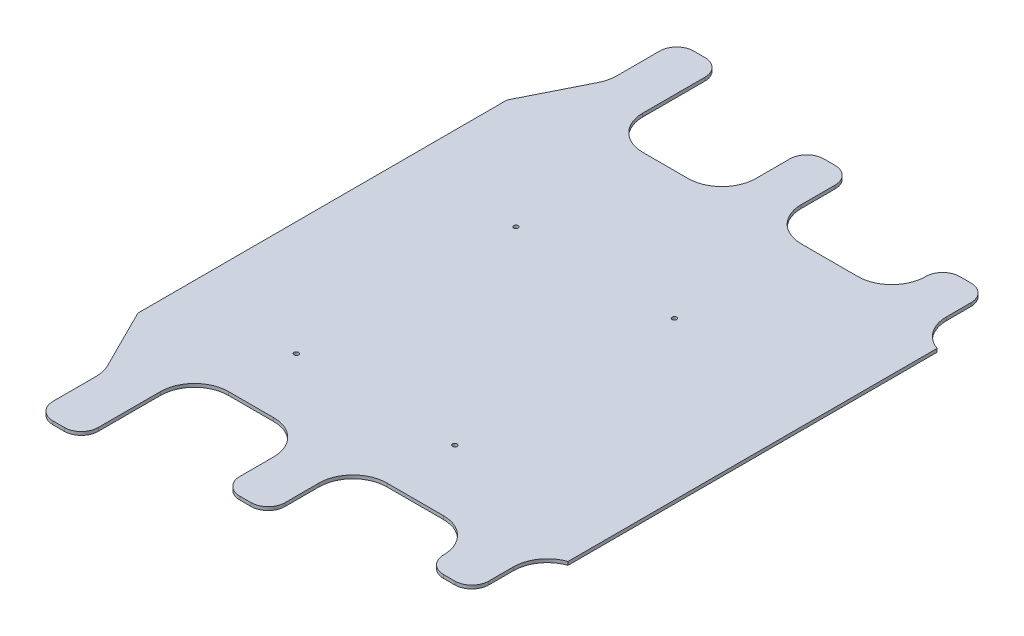
from build123d import *

# Parameters (mm, degrees)
SKETCH1_W             = 380
SKETCH1_H             = 326
BOSS_EXTRUDE1_DEPTH   = 3
SKETCH2_R             = 2
PCB_PLATE_HOLES_DEPTH = 3
BOSS_EXTRUDE2_DEPTH   = 3
FILLET1_R             = 30
FILLET2_R             = 15


# Some blends are built 0.0001 mm under size
with BuildPart() as part:
    # Sketch1 → Boss-Extrude1 (new body)
    with BuildSketch(Plane(origin=(0, 0, 0), x_dir=(1, 0, 0), z_dir=(0, 1, 0))):
        Rectangle(SKETCH1_W, SKETCH1_H)
    extrude(amount=BOSS_EXTRUDE1_DEPTH)

    # Sketch2 → PCB Plate Holes (cut)
    with BuildSketch(Plane(origin=(0, 3, 0), x_dir=(1, 0, 0), z_dir=(0, 1, 0))):
        with Locations(Location((51, 70, 0), (0, 0, 270))):
            Circle(SKETCH2_R)
        with Locations(Location((-89, 70, 0), (0, 0, 270))):
            Circle(SKETCH2_R)
        with Locations(Location((51, -124, 0), (0, 0, 270))):
            Circle(SKETCH2_R)
        with Locations(Location((-89, -124, 0), (0, 0, 270))):
            Circle(SKETCH2_R)
    extrude(amount=-PCB_PLATE_HOLES_DEPTH, mode=Mode.SUBTRACT)

    # Sketch3 → Boss-Extrude2 (add)
    with BuildSketch(Plane(origin=(0, 3, 0), x_dir=(1, 0, 0), z_dir=(0, 1, 0))):
        Polygon((170, 163), (170, 228), (130, 228), (130, 183), (20, 183), (20, 258), (-20, 258), (-20, 183), (-120, 183), (-120, 283), (-160, 283), (-160, 223), (-190, 163), align=None)
        Polygon((170, -228), (170, -163), (-190, -163), (-160, -223), (-160, -283), (-120, -283), (-120, -183), (-20, -183), (-20, -258), (20, -258), (20, -183), (130, -183), (130, -228), align=None)
    extrude(amount=-BOSS_EXTRUDE2_DEPTH)

    # Fillet1
    # the kernel refuses this fillet: 30 mm, written as the material it adds along each edge
    with BuildSketch(Plane(origin=(130, 3, -183), x_dir=(0, 0, -1), z_dir=(0, -1, 0)), Plane(origin=(20, 3, -183), x_dir=(1, 0, 0), z_dir=(0, -1, 0)), Plane(origin=(-20, 3, -183), x_dir=(0, 0, -1), z_dir=(0, -1, 0)), Plane(origin=(-120, 3, -183), x_dir=(1, 0, 0), z_dir=(0, -1, 0)), Plane(origin=(20, 3, 183), x_dir=(0, 0, 1), z_dir=(0, -1, 0)), Plane(origin=(130, 3, 183), x_dir=(-1, 0, 0), z_dir=(0, -1, 0)), Plane(origin=(-20, 3, 183), x_dir=(-1, 0, 0), z_dir=(0, -1, 0)), Plane(origin=(-120, 3, 183), x_dir=(0, 0, 1), z_dir=(0, -1, 0))) as fillet1_piece_1:
        with BuildLine():
            CenterArc((FILLET1_R, -FILLET1_R), FILLET1_R, 90, 90)
            Line((0, -FILLET1_R), (-FILLET1_R * 0.02, -FILLET1_R))
            Line((-FILLET1_R * 0.02, -FILLET1_R), (-FILLET1_R * 0.02, FILLET1_R * 0.02))
            Line((-FILLET1_R * 0.02, FILLET1_R * 0.02), (FILLET1_R, FILLET1_R * 0.02))
            Line((FILLET1_R, FILLET1_R * 0.02), (FILLET1_R, 0))
        make_face()
    extrude(amount=3)
    with BuildSketch(Plane(origin=(170, 3, -163), x_dir=(1, 0, 0), z_dir=(0, -1, 0))) as fillet1_piece_2:
        with BuildLine():
            CenterArc((30, -28.284271247), FILLET1_R, 109.471220634, 70.528779366)
            Line((0, -28.284271247), (-0.6, -28.284271247))
            Line((-0.6, -28.284271247), (-0.6, 0))
            Line((-0.6, 0), (0, 0.6))
            ThreePointArc((0, 0.6), (10, 0.6), (19.8, 0.565685425))
            Line((19.8, 0.565685425), (20, 0))
        make_face()
    extrude(amount=3)
    with BuildSketch(Plane(origin=(170, 3, 163), x_dir=(1, 0, 0), z_dir=(0, -1, 0))) as fillet1_piece_3:
        with BuildLine():
            CenterArc((30, 28.284271247), FILLET1_R, 180, 70.528779366)
            Line((0, 28.284271247), (-0.6, 28.284271247))
            Line((-0.6, 28.284271247), (-0.6, 0))
            Line((-0.6, 0), (0, -0.6))
            ThreePointArc((0, -0.6), (10, -0.6), (19.8, -0.565685425))
            Line((19.8, -0.565685425), (20, 0))
        make_face()
    extrude(amount=3)
    with BuildSketch(Plane(origin=(-160, 3, -223), x_dir=(-0.44721359549995476, 0, 0.8944271909999175), z_dir=(0, -1, 0))) as fillet1_piece_4:
        with BuildLine():
            CenterArc((FILLET1_R * 0.2360679775, FILLET1_R), FILLET1_R, 243.434948823, 26.565051177)
            Line((-FILLET1_R * 0.211145618, FILLET1_R * 0.105572809), (-FILLET1_R * 0.22008988991, FILLET1_R * 0.0876842651801))
            Line((-FILLET1_R * 0.22008988991, FILLET1_R * 0.0876842651801), (-FILLET1_R * 0.00472135955, -FILLET1_R * 0.02))
            Line((-FILLET1_R * 0.00472135955, -FILLET1_R * 0.02), (FILLET1_R * 0.2360679775, -FILLET1_R * 0.02))
            Line((FILLET1_R * 0.2360679775, -FILLET1_R * 0.02), (FILLET1_R * 0.2360679775, 0))
        make_face()
    extrude(amount=3)
    with BuildSketch(Plane(origin=(-160, 3, 223), x_dir=(-0.4472135954999563, 0, -0.8944271909999166), z_dir=(0, -1, 0))) as fillet1_piece_5:
        with BuildLine():
            CenterArc((FILLET1_R * 0.2360679775, -FILLET1_R), FILLET1_R, 90, 26.565051177)
            Line((-FILLET1_R * 0.211145618, -FILLET1_R * 0.105572809), (-FILLET1_R * 0.22008988991, -FILLET1_R * 0.0876842651801))
            Line((-FILLET1_R * 0.22008988991, -FILLET1_R * 0.0876842651801), (-FILLET1_R * 0.00472135955, FILLET1_R * 0.02))
            Line((-FILLET1_R * 0.00472135955, FILLET1_R * 0.02), (FILLET1_R * 0.2360679775, FILLET1_R * 0.02))
            Line((FILLET1_R * 0.2360679775, FILLET1_R * 0.02), (FILLET1_R * 0.2360679775, 0))
        make_face()
    extrude(amount=3)

    # Fillet2
    fillet2_edges = [part.edges().sort_by_distance(p)[0] for p in [
        (170, 1.5, 228),
        (130, 1.5, 228),
        (20, 1.5, 258),
        (-120, 1.5, 283),
        (-20, 1.5, 258),
        (170, 1.5, -228),
        (130, 1.5, -228),
        (20, 1.5, -258),
        (-20, 1.5, -258),
        (-120, 1.5, -283),
        (-160, 1.5, -283),
        (-160, 1.5, 283),
    ]]
    fillet(fillet2_edges, radius=FILLET2_R - 0.0001)  # a hair under: the kernel refuses the full size


solid = part.part
